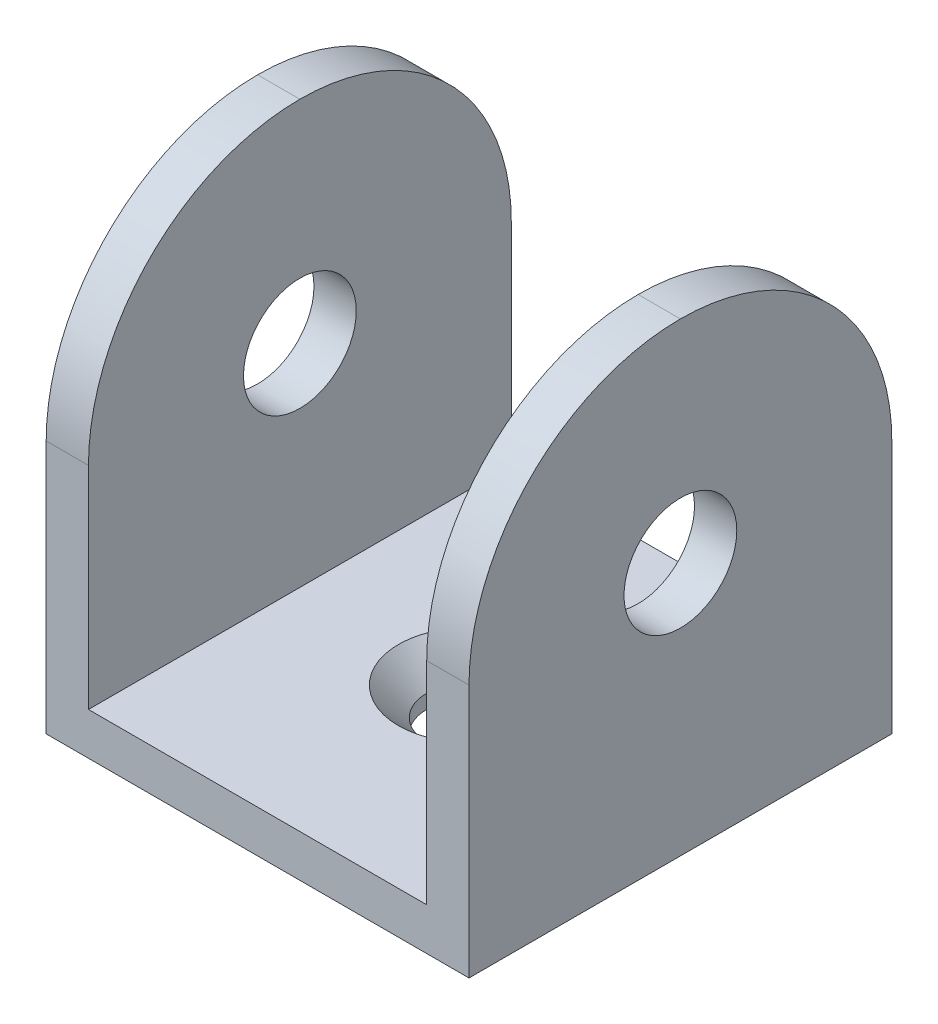
from build123d import *

# Parameters (mm, degrees)
CROQUIS1_W              = 30
CROQUIS1_H              = 30
SALIENTE_EXTRUIR1_DEPTH = 3
CROQUIS2_W              = 3
CROQUIS2_H              = 30
SALIENTE_EXTRUIR2_DEPTH = 30
REDONDEO1_R             = 15
CROQUIS3_R              = 4
CORTAR_EXTRUIR1_DEPTH   = 48.053161424
CROQUIS4_R              = 3
CORTAR_EXTRUIR2_DEPTH   = 37.742346142
CHAFL_N1_SIZE           = 2


with BuildPart() as part:
    # Croquis1 → Saliente-Extruir1 (new body)
    with BuildSketch(Plane(origin=(0, 0, 0), x_dir=(1, 0, 0), z_dir=(0, 1, 0))):
        Rectangle(CROQUIS1_W, CROQUIS1_H)
    extrude(amount=SALIENTE_EXTRUIR1_DEPTH)

    # Croquis2 → Saliente-Extruir2 (add)
    with BuildSketch(Plane(origin=(0, 3, 0), x_dir=(1, 0, 0), z_dir=(0, 1, 0))):
        with Locations((-13.5, 0)):
            Rectangle(CROQUIS2_W, CROQUIS2_H)
        with Locations((13.5, 0)):
            Rectangle(CROQUIS2_W, CROQUIS2_H)
    extrude(amount=SALIENTE_EXTRUIR2_DEPTH)

    # Redondeo1
    redondeo1_edges = [part.edges().sort_by_distance(p)[0] for p in [
        (-13.5, 33, -15),
        (13.5, 33, -15),
        (13.5, 33, 15),
        (-13.5, 33, 15),
    ]]
    fillet(redondeo1_edges, radius=REDONDEO1_R - 0.0001)  # a hair under: the kernel refuses the full size

    # Croquis3 → Cortar-Extruir1 (cut, through all)
    with BuildSketch(Plane(origin=(15, 0, 0), x_dir=(0, 0, -1), z_dir=(1, 0, 0))):
        with Locations((0, 18)):
            Circle(CROQUIS3_R)
    extrude(amount=-CORTAR_EXTRUIR1_DEPTH, mode=Mode.SUBTRACT)

    # Croquis4 → Cortar-Extruir2 (cut, through all)
    with BuildSketch(Plane(origin=(0, 3, 0), x_dir=(1, 0, 0), z_dir=(0, 1, 0))):
        with Locations(Location((0, 0, 0), (0, 0, 270))):
            Circle(CROQUIS4_R)
    extrude(amount=-CORTAR_EXTRUIR2_DEPTH, mode=Mode.SUBTRACT)

    # Chaflán1
    chafl_n1_edges = [part.edges().sort_by_distance(p)[0] for p in [
        (0, 3, -3),
    ]]
    chamfer(chafl_n1_edges, length=CHAFL_N1_SIZE)


solid = part.part
